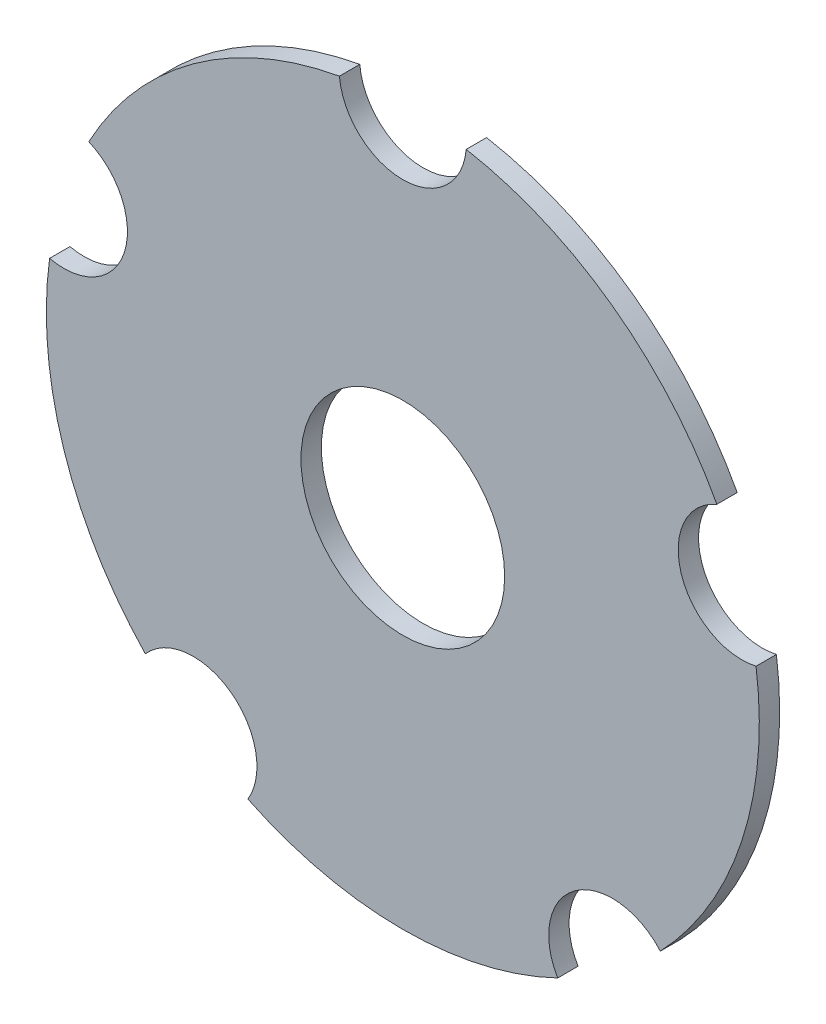
from build123d import *

# Parameters (mm, degrees)
SKETCH2_R           = 10
BOSS_EXTRUDE2_DEPTH = 2


with BuildPart() as part:
    # Sketch2 → Boss-Extrude2 (new body)
    with BuildSketch(Plane.XY):
        with BuildLine():
            ThreePointArc((-6.225037843, 34.441964286), (-20.57248383, 28.315594803), (-30.832612084, 16.563515088))
            ThreePointArc((-30.832612084, 16.563515088), (-27.342874843, 8.884238588), (-34.679897052, 4.72278948))
            ThreePointArc((-34.679897052, 4.72278948), (-33.28697807, -10.815594803), (-25.280640072, -24.205148988))
            ThreePointArc((-25.280640072, -24.205148988), (-16.898826003, -23.259238588), (-15.208317262, -31.523119866))
            ThreePointArc((-15.208317262, -31.523119866), (0, -35), (15.208317262, -31.523119866))
            ThreePointArc((15.208317262, -31.523119866), (16.898826003, -23.259238588), (25.280640072, -24.205148988))
            ThreePointArc((25.280640072, -24.205148988), (33.28697807, -10.815594803), (34.679897052, 4.72278948))
            ThreePointArc((34.679897052, 4.72278948), (27.342874843, 8.884238588), (30.832612084, 16.563515088))
            ThreePointArc((30.832612084, 16.563515088), (20.57248383, 28.315594803), (6.225037843, 34.441964286))
            ThreePointArc((6.225037843, 34.441964286), (0, 28.75), (-6.225037843, 34.441964286))
        make_face()
        Circle(SKETCH2_R, mode=Mode.SUBTRACT)
    extrude(amount=BOSS_EXTRUDE2_DEPTH)


solid = part.part
